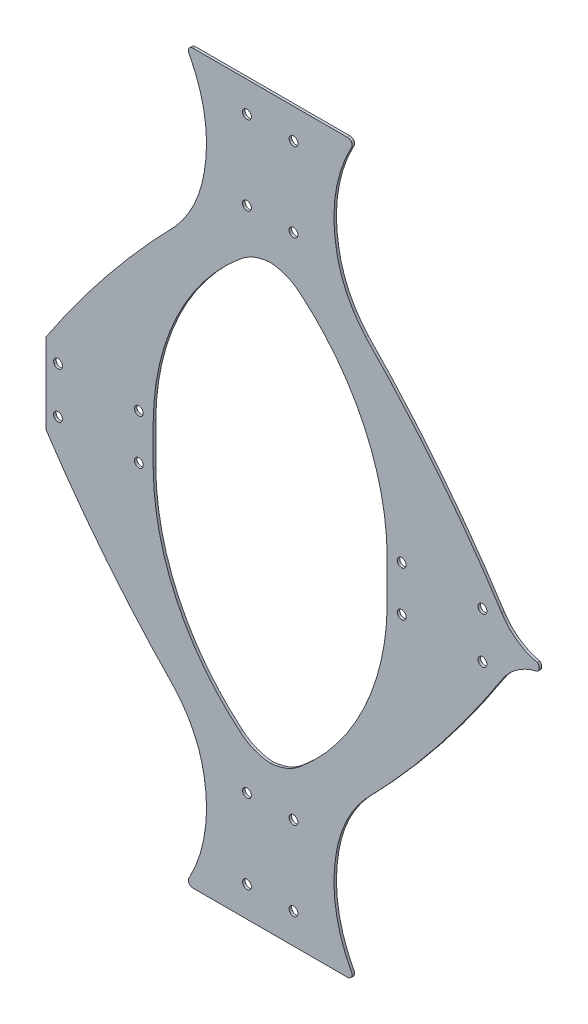
from build123d import *

# Parameters (mm, degrees)
SKETCH2_R               = 11.1125
BOSS_EXTRUDE1_DEPTH     = 6.35
CUT_EXTRUDE1_DEPTH      = 1138.328360493
CUT_EXTRUDE1_DEPTH_BACK = 1138.328360493


with BuildPart() as part:
    # Sketch2 → Boss-Extrude1 (new body)
    with BuildSketch(Plane.XY):
        with BuildLine():
            Line((0, 914.4), (-194.479849892, 914.4))
            ThreePointArc((-194.479849892, 914.4), (-204.91887294, 907.625287079), (-202.983200568, 895.332073104))
            ThreePointArc((-202.983200568, 895.332073104), (-164.535916973, 779.903104595), (-165.892020397, 658.247026365))
            Line((-165.892020397, 658.247026365), (-165.938886188, 658.129795086))
            ThreePointArc((-165.938886188, 658.129795086), (-174.522720833, 620.054602536), (-187.919807247, 583.395080165))
            ThreePointArc((-187.919807247, 583.395080165), (-210.62430537, 541.201744159), (-239.683438479, 503.105305725))
            ThreePointArc((-239.683438479, 503.105305725), (-421.799875663, 296.628923536), (-582.037423098, 72.747657042))
            ThreePointArc((-582.037423098, 72.747657042), (-620.339092238, 32.211350912), (-671.307126152, 9.573561873))
            ThreePointArc((-671.307126152, 9.573561873), (-674.990888604, 5.409489794), (-676.274252252, 0))
            ThreePointArc((-676.274252252, 0), (-674.990888604, -5.409489794), (-671.307126152, -9.573561873))
            ThreePointArc((-671.307126152, -9.573561873), (-620.339092238, -32.211350912), (-582.037423098, -72.747657042))
            ThreePointArc((-582.037423098, -72.747657042), (-421.799875663, -296.628923536), (-239.683438479, -503.105305725))
            ThreePointArc((-239.683438479, -503.105305725), (-191.627212465, -575.297388544), (-165.938886188, -658.129795086))
            Line((-165.938886188, -658.129795086), (-165.892020397, -658.247026365))
            ThreePointArc((-165.892020397, -658.247026365), (-164.535916973, -779.903104595), (-202.983200568, -895.332073104))
            ThreePointArc((-202.983200568, -895.332073104), (-204.91887294, -907.625287079), (-194.479849892, -914.4))
            Line((-194.479849892, -914.4), (0, -914.4))
            Line((0, -914.4), (194.479849892, -914.4))
            ThreePointArc((194.479849892, -914.4), (204.91887294, -907.625287079), (202.983200568, -895.332073104))
            ThreePointArc((202.983200568, -895.332073104), (164.535916973, -779.903104595), (165.892020397, -658.247026365))
            Line((165.892020397, -658.247026365), (165.938886188, -658.129795086))
            ThreePointArc((165.938886188, -658.129795086), (174.522720833, -620.054602536), (187.919807247, -583.395080165))
            ThreePointArc((187.919807247, -583.395080165), (210.62430537, -541.201744159), (239.683438479, -503.105305725))
            ThreePointArc((239.683438479, -503.105305725), (421.799875663, -296.628923536), (582.037423098, -72.747657043))
            ThreePointArc((582.037423098, -72.747657043), (620.339092238, -32.211350912), (671.307126152, -9.573561873))
            ThreePointArc((671.307126152, -9.573561873), (674.990888603, -5.409489794), (676.274252252, 0))
            ThreePointArc((676.274252252, 0), (674.990888604, 5.409489794), (671.307126152, 9.573561873))
            ThreePointArc((671.307126152, 9.573561873), (620.339092238, 32.211350912), (582.037423098, 72.747657042))
            ThreePointArc((582.037423098, 72.747657042), (421.799875663, 296.628923536), (239.683438479, 503.105305725))
            ThreePointArc((239.683438479, 503.105305725), (191.627212465, 575.297388544), (165.938886188, 658.129795086))
            Line((165.938886188, 658.129795086), (165.892020397, 658.247026365))
            ThreePointArc((165.892020397, 658.247026365), (164.535916973, 779.903104595), (202.983200568, 895.332073104))
            ThreePointArc((202.983200568, 895.332073104), (204.91887294, 907.625287079), (194.479849892, 914.4))
            Line((194.479849892, 914.4), (0, 914.4))
        make_face()
        with Locations((-58.541769794, -639.405335996)):
            Circle(SKETCH2_R, mode=Mode.SUBTRACT)
        with Locations((-58.541769794, -838.268909678)):
            Circle(SKETCH2_R, mode=Mode.SUBTRACT)
        with Locations((58.541769794, -838.268909678)):
            Circle(SKETCH2_R, mode=Mode.SUBTRACT)
        with Locations((58.541769794, -639.405335996)):
            Circle(SKETCH2_R, mode=Mode.SUBTRACT)
        with Locations((533.590599666, -57.767812484)):
            Circle(SKETCH2_R, mode=Mode.SUBTRACT)
        with Locations((330.356144827, -56.532187516)):
            Circle(SKETCH2_R, mode=Mode.SUBTRACT)
        with Locations((330.356144827, 56.532187516)):
            Circle(SKETCH2_R, mode=Mode.SUBTRACT)
        with Locations((533.590599666, 57.767812484)):
            Circle(SKETCH2_R, mode=Mode.SUBTRACT)
        with Locations((58.541769794, 838.268909678)):
            Circle(SKETCH2_R, mode=Mode.SUBTRACT)
        with Locations((-58.541769794, 838.268909678)):
            Circle(SKETCH2_R, mode=Mode.SUBTRACT)
        with Locations((-58.541769794, 639.405335996)):
            Circle(SKETCH2_R, mode=Mode.SUBTRACT)
        with Locations((58.541769794, 639.405335996)):
            Circle(SKETCH2_R, mode=Mode.SUBTRACT)
        with Locations((-330.356144827, -56.532187516)):
            Circle(SKETCH2_R, mode=Mode.SUBTRACT)
        with Locations((-330.356144827, 56.532187516)):
            Circle(SKETCH2_R, mode=Mode.SUBTRACT)
        with Locations((-533.590599666, 57.767812484)):
            Circle(SKETCH2_R, mode=Mode.SUBTRACT)
        with Locations((-533.590599666, -57.767812484)):
            Circle(SKETCH2_R, mode=Mode.SUBTRACT)
        with BuildLine():
            Line((294.116579618, 52.07611641), (294.116579618, -52.07611641))
            ThreePointArc((294.116579618, -52.07611641), (242.916605185, -291.544447454), (101.6983636, -491.604256507))
            ThreePointArc((101.6983636, -491.604256507), (89.07407881, -503.133976698), (76.131755899, -514.305516063))
            ThreePointArc((76.131755899, -514.305516063), (40.620898237, -536.014461284), (0, -545.083195538))
            ThreePointArc((0, -545.083195538), (-40.620898237, -536.014461284), (-76.131755899, -514.305516063))
            ThreePointArc((-76.131755899, -514.305516063), (-235.841357727, -307.108762007), (-294.116579618, -52.07611641))
            Line((-294.116579618, -52.07611641), (-294.116579618, 52.07611641))
            ThreePointArc((-294.116579618, 52.07611641), (-242.916605185, 291.544447454), (-101.6983636, 491.604256507))
            ThreePointArc((-101.6983636, 491.604256507), (-89.07407881, 503.133976698), (-76.131755899, 514.305516063))
            ThreePointArc((-76.131755899, 514.305516063), (-40.620898237, 536.014461284), (0, 545.083195538))
            ThreePointArc((0, 545.083195538), (40.620898237, 536.014461284), (76.131755899, 514.305516063))
            ThreePointArc((76.131755899, 514.305516063), (235.841357727, 307.108762007), (294.116579618, 52.07611641))
        make_face(mode=Mode.SUBTRACT)
    extrude(amount=BOSS_EXTRUDE1_DEPTH)

    # Sketch4 → Cut-Extrude1 (cut, two sides: drawn at the far end of the back side and taken through both)
    with BuildSketch(Plane.XY.offset(6.35).offset(-CUT_EXTRUDE1_DEPTH_BACK)):
        Polygon((-563.100251331, -3317.364036568), (-563.100251331, -101.854), (-563.100251331, 101.854), (-563.100251331, 3317.364036568), (-6994.120324467, 3317.364036568), (-6994.120324467, -3317.364036568), align=None)
    extrude(amount=CUT_EXTRUDE1_DEPTH + CUT_EXTRUDE1_DEPTH_BACK, mode=Mode.SUBTRACT)


solid = part.part
